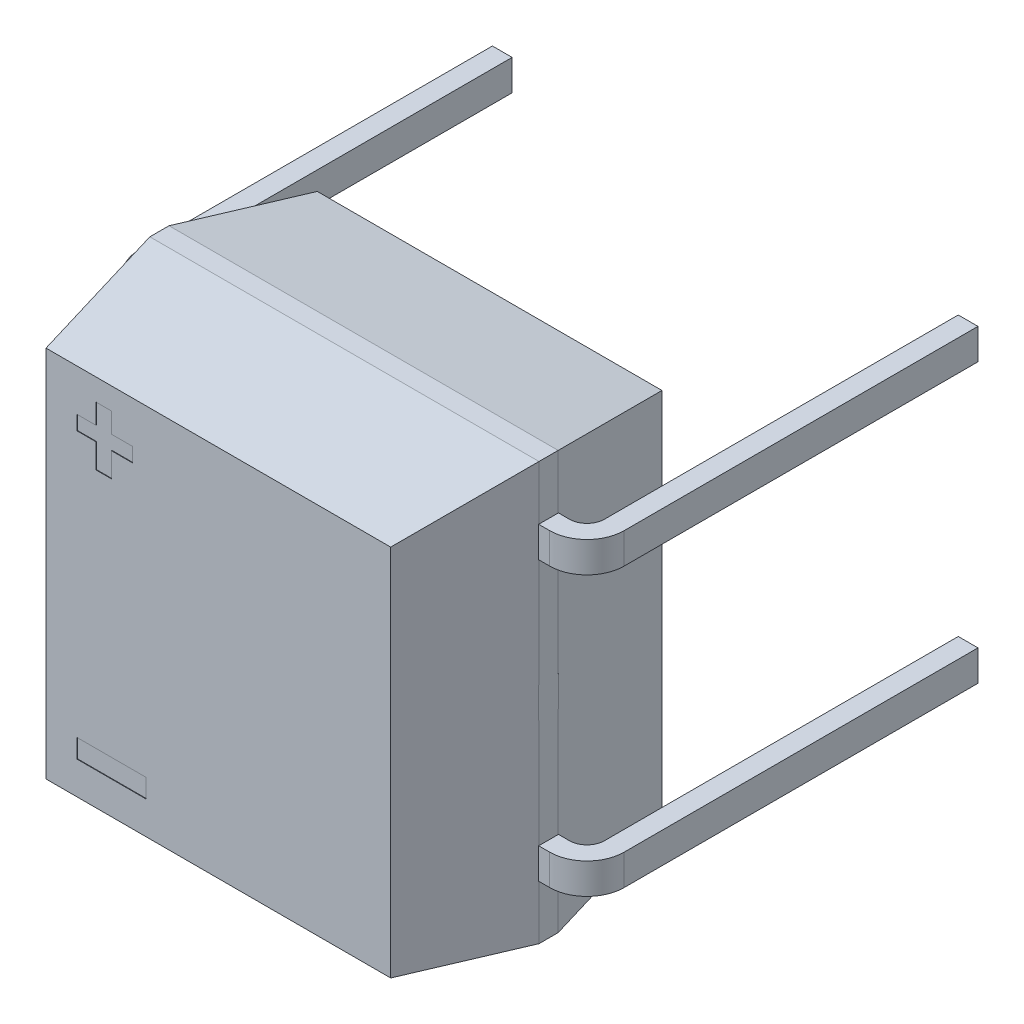
from build123d import *

# Parameters (mm, degrees)
EXTRUDE_1_DEPTH     = 4.95
SKETCH_5_W          = 0.36
SKETCH_5_H          = 0.56
SKETCH_5_2_W        = 0.36
SKETCH_5_2_H        = 0.56
EXTRUDE_2_DEPTH     = 4.1
CHAMFER_1_SIZE      = 2.3
CHAMFER_1_SIZE_2    = 0.405552056
SKETCH_6_W          = 1.256035052
SKETCH_6_H          = 0.342555014
CUT_EXTRUDE_1_DEPTH = 0.01
SKETCH_7_W          = 10.556189846
SKETCH_7_H          = 3.652287582
CUT_EXTRUDE_2_DEPTH = 20
CHAMFER_2_SIZE      = 2.3
CHAMFER_2_SIZE2     = 0.405552056
SKETCH_8_W          = 1.558579466
SKETCH_8_H          = 2.253785059
SKETCH_8_W_2        = 1.350537768
SKETCH_8_H_2        = 2.346248035
CUT_EXTRUDE_3_DEPTH = 20
SKETCH_9_R          = 0.093378716
CUT_EXTRUDE_4_DEPTH = 2


with BuildPart() as part:
    # Эскиз3 → Вытянуть1 (new body)
    with BuildSketch(Plane.XY.offset(5.33)):
        Polygon((0.7, 1.27), (4.25, 1.27), (7.8, 1.27), (7.8, -8.89), (0.7, -8.89), align=None)
    extrude(amount=-EXTRUDE_1_DEPTH)

    # По траектории1: sweep along a path in Эскиз4
    with BuildLine(Plane(origin=(0, 0, 0), x_dir=(1, 0, 0), z_dir=(0, 1, 0))) as sweep_1_path:
        Line((0, 0), (0, -2.355))
        ThreePointArc((0, -2.355), (0.146446609, -2.708553391), (0.5, -2.855))
        Line((0.5, -2.855), (0.7, -2.855))
        Line((0.7, -2.855), (7.8, -2.855))
        Line((7.8, -2.855), (8, -2.855))
        ThreePointArc((8, -2.855), (8.353553391, -2.708553391), (8.5, -2.355))
        Line((8.5, -2.355), (8.5, 0))
        Line((8.5, 0), (8.5, 4.1))
    # Эскиз5 → По траектории1 (sweep)
    with BuildSketch(Plane.XY):
        with Locations((0, -2.54)):
            Rectangle(SKETCH_5_W, SKETCH_5_H)
        Rectangle(SKETCH_5_W, SKETCH_5_H)
        with Locations((0, -5.08)):
            Rectangle(SKETCH_5_W, SKETCH_5_H)
        with Locations((0, -7.62)):
            Rectangle(SKETCH_5_W, SKETCH_5_H)
    sweep(path=sweep_1_path.line)

    # Эскиз5<2> → Вытянуть2 (add)
    with BuildSketch(Plane.XY):
        with Locations((0, -2.54)):
            Rectangle(SKETCH_5_2_W, SKETCH_5_2_H)
        Rectangle(SKETCH_5_2_W, SKETCH_5_2_H)
        with Locations((0, -5.08)):
            Rectangle(SKETCH_5_2_W, SKETCH_5_2_H)
        with Locations((0, -7.62)):
            Rectangle(SKETCH_5_2_W, SKETCH_5_2_H)
    extrude(amount=-EXTRUDE_2_DEPTH)

    # Фаска1
    # the kernel refuses this chamfer: 2.3, 0.405552056 mm, written as the material it takes off along each edge
    with BuildSketch(Plane(origin=(13.776639232, -8.89, 0.38), x_dir=(0, -0.006682531656101655, 0.9999776716360548), z_dir=(-1, 0, 0))) as chamfer_1_piece_1:
        Polygon((CHAMFER_1_SIZE * 0.999977671636, CHAMFER_1_SIZE * 0.0066825316561), (-CHAMFER_1_SIZE_2 * 0.00668253165, CHAMFER_1_SIZE_2 * 0.999977670722), (0, 0), align=None)
    extrude(amount=19.053278464, mode=Mode.SUBTRACT)
    with BuildSketch(Plane(origin=(13.776639232, -8.89, 5.33), x_dir=(4.402885138150507e-15, 0.9776715712462588, 0.2101387607674306), z_dir=(-1, 0, 0))) as chamfer_1_piece_2:
        Polygon((CHAMFER_1_SIZE_2 * 0.977671570353, CHAMFER_1_SIZE_2 * 0.210138760575), (-CHAMFER_1_SIZE * 0.210138760767, CHAMFER_1_SIZE * 0.977671571246), (0, 0), align=None)
    extrude(amount=19.053278464, mode=Mode.SUBTRACT)
    with BuildSketch(Plane(origin=(7.8, 7.246639232, 0.38), x_dir=(0.006682531656101655, 0, 0.9999776716360548), z_dir=(0, -1, 0))) as chamfer_1_piece_3_section:
        Polygon((CHAMFER_1_SIZE * 0.999977671636, CHAMFER_1_SIZE * 0.0066825316561), (-CHAMFER_1_SIZE_2 * 0.00668253165, CHAMFER_1_SIZE_2 * 0.999977670722), (0, 0), align=None)
    chamfer_1_piece_3 = extrude(amount=22.113278464, mode=Mode.PRIVATE)
    chamfer_1_piece_3 = split(chamfer_1_piece_3, bisect_by=Plane(origin=(7.799706122, 0.28, 2.676666667), z_dir=(0, 1, 0)), keep=Keep.TOP, mode=Mode.PRIVATE)
    add(chamfer_1_piece_3, mode=Mode.SUBTRACT)
    with BuildSketch(Plane(origin=(7.8, 7.246639232, 0.38), x_dir=(0.006682531656101655, 0, 0.9999776716360548), z_dir=(0, -1, 0))) as chamfer_1_piece_4_section:
        Polygon((CHAMFER_1_SIZE * 0.999977671636, CHAMFER_1_SIZE * 0.0066825316561), (-CHAMFER_1_SIZE_2 * 0.00668253165, CHAMFER_1_SIZE_2 * 0.999977670722), (0, 0), align=None)
    chamfer_1_piece_4 = extrude(amount=22.113278464, mode=Mode.PRIVATE)
    chamfer_1_piece_4 = split(chamfer_1_piece_4, bisect_by=Plane(origin=(7.664815344, 0, 2.675), z_dir=(0, 0, -1)), keep=Keep.TOP, mode=Mode.PRIVATE)
    add(chamfer_1_piece_4, mode=Mode.SUBTRACT)
    with BuildSketch(Plane(origin=(7.8, 7.246639232, 0.38), x_dir=(0.006682531656101655, 0, 0.9999776716360548), z_dir=(0, -1, 0))) as chamfer_1_piece_5_section:
        Polygon((CHAMFER_1_SIZE * 0.999977671636, CHAMFER_1_SIZE * 0.0066825316561), (-CHAMFER_1_SIZE_2 * 0.00668253165, CHAMFER_1_SIZE_2 * 0.999977670722), (0, 0), align=None)
    chamfer_1_piece_5 = extrude(amount=22.113278464, mode=Mode.PRIVATE)
    chamfer_1_piece_5 = split(chamfer_1_piece_5, bisect_by=Plane(origin=(7.799706122, -2.26, 2.676666667), z_dir=(0, 1, 0)), keep=Keep.TOP, mode=Mode.PRIVATE)
    chamfer_1_piece_5 = split(chamfer_1_piece_5, bisect_by=Plane(origin=(7.799706122, -0.28, 2.676666667), z_dir=(0, -1, 0)), keep=Keep.TOP, mode=Mode.PRIVATE)
    add(chamfer_1_piece_5, mode=Mode.SUBTRACT)
    with BuildSketch(Plane(origin=(7.8, 7.246639232, 0.38), x_dir=(0.006682531656101655, 0, 0.9999776716360548), z_dir=(0, -1, 0))) as chamfer_1_piece_6_section:
        Polygon((CHAMFER_1_SIZE * 0.999977671636, CHAMFER_1_SIZE * 0.0066825316561), (-CHAMFER_1_SIZE_2 * 0.00668253165, CHAMFER_1_SIZE_2 * 0.999977670722), (0, 0), align=None)
    chamfer_1_piece_6 = extrude(amount=22.113278464, mode=Mode.PRIVATE)
    chamfer_1_piece_6 = split(chamfer_1_piece_6, bisect_by=Plane(origin=(7.799706122, -2.82, 2.676666667), z_dir=(0, -1, 0)), keep=Keep.TOP, mode=Mode.PRIVATE)
    chamfer_1_piece_6 = split(chamfer_1_piece_6, bisect_by=Plane(origin=(7.799706122, -4.8, 2.676666667), z_dir=(0, 1, 0)), keep=Keep.TOP, mode=Mode.PRIVATE)
    add(chamfer_1_piece_6, mode=Mode.SUBTRACT)
    with BuildSketch(Plane(origin=(7.8, 7.246639232, 0.38), x_dir=(0.006682531656101655, 0, 0.9999776716360548), z_dir=(0, -1, 0))) as chamfer_1_piece_7_section:
        Polygon((CHAMFER_1_SIZE * 0.999977671636, CHAMFER_1_SIZE * 0.0066825316561), (-CHAMFER_1_SIZE_2 * 0.00668253165, CHAMFER_1_SIZE_2 * 0.999977670722), (0, 0), align=None)
    chamfer_1_piece_7 = extrude(amount=22.113278464, mode=Mode.PRIVATE)
    chamfer_1_piece_7 = split(chamfer_1_piece_7, bisect_by=Plane(origin=(7.799706122, -7.34, 2.676666667), z_dir=(0, 1, 0)), keep=Keep.TOP, mode=Mode.PRIVATE)
    chamfer_1_piece_7 = split(chamfer_1_piece_7, bisect_by=Plane(origin=(7.799706122, -5.36, 2.676666667), z_dir=(0, -1, 0)), keep=Keep.TOP, mode=Mode.PRIVATE)
    add(chamfer_1_piece_7, mode=Mode.SUBTRACT)
    with BuildSketch(Plane(origin=(7.8, 7.246639232, 0.38), x_dir=(0.006682531656101655, 0, 0.9999776716360548), z_dir=(0, -1, 0))) as chamfer_1_piece_8_section:
        Polygon((CHAMFER_1_SIZE * 0.999977671636, CHAMFER_1_SIZE * 0.0066825316561), (-CHAMFER_1_SIZE_2 * 0.00668253165, CHAMFER_1_SIZE_2 * 0.999977670722), (0, 0), align=None)
    chamfer_1_piece_8 = extrude(amount=22.113278464, mode=Mode.PRIVATE)
    chamfer_1_piece_8 = split(chamfer_1_piece_8, bisect_by=Plane(origin=(7.799706122, -7.9, 2.676666667), z_dir=(0, -1, 0)), keep=Keep.TOP, mode=Mode.PRIVATE)
    add(chamfer_1_piece_8, mode=Mode.SUBTRACT)
    with BuildSketch(Plane(origin=(7.8, 7.246639232, 5.33), x_dir=(-0.9776715712462587, -1.3674752616302956e-15, 0.21013876076743102), z_dir=(0, -1, 0))) as chamfer_1_piece_9_section:
        Polygon((CHAMFER_1_SIZE_2 * 0.977671570353, CHAMFER_1_SIZE_2 * 0.210138760575), (-CHAMFER_1_SIZE * 0.210138760767, CHAMFER_1_SIZE * 0.977671571246), (0, 0), align=None)
    chamfer_1_piece_9 = extrude(amount=22.113278464, mode=Mode.PRIVATE)
    chamfer_1_piece_9 = split(chamfer_1_piece_9, bisect_by=Plane(origin=(7.664815344, 0.775, 3.035), z_dir=(0, 0, 1)), keep=Keep.TOP, mode=Mode.PRIVATE)
    add(chamfer_1_piece_9, mode=Mode.SUBTRACT)
    with BuildSketch(Plane(origin=(7.8, 7.246639232, 5.33), x_dir=(-0.9776715712462587, -1.3674752616302956e-15, 0.21013876076743102), z_dir=(0, -1, 0))) as chamfer_1_piece_10_section:
        Polygon((CHAMFER_1_SIZE_2 * 0.977671570353, CHAMFER_1_SIZE_2 * 0.210138760575), (-CHAMFER_1_SIZE * 0.210138760767, CHAMFER_1_SIZE * 0.977671571246), (0, 0), align=None)
    chamfer_1_piece_10 = extrude(amount=22.113278464, mode=Mode.PRIVATE)
    chamfer_1_piece_10 = split(chamfer_1_piece_10, bisect_by=Plane(origin=(7.799706122, 0.28, 3.033333333), z_dir=(0, 1, 0)), keep=Keep.TOP, mode=Mode.PRIVATE)
    add(chamfer_1_piece_10, mode=Mode.SUBTRACT)
    with BuildSketch(Plane(origin=(7.8, 7.246639232, 5.33), x_dir=(-0.9776715712462587, -1.3674752616302956e-15, 0.21013876076743102), z_dir=(0, -1, 0))) as chamfer_1_piece_11_section:
        Polygon((CHAMFER_1_SIZE_2 * 0.977671570353, CHAMFER_1_SIZE_2 * 0.210138760575), (-CHAMFER_1_SIZE * 0.210138760767, CHAMFER_1_SIZE * 0.977671571246), (0, 0), align=None)
    chamfer_1_piece_11 = extrude(amount=22.113278464, mode=Mode.PRIVATE)
    chamfer_1_piece_11 = split(chamfer_1_piece_11, bisect_by=Plane(origin=(7.799706122, -2.26, 3.033333333), z_dir=(0, 1, 0)), keep=Keep.TOP, mode=Mode.PRIVATE)
    chamfer_1_piece_11 = split(chamfer_1_piece_11, bisect_by=Plane(origin=(7.799706122, -0.28, 3.033333333), z_dir=(0, -1, 0)), keep=Keep.TOP, mode=Mode.PRIVATE)
    add(chamfer_1_piece_11, mode=Mode.SUBTRACT)
    with BuildSketch(Plane(origin=(7.8, 7.246639232, 5.33), x_dir=(-0.9776715712462587, -1.3674752616302956e-15, 0.21013876076743102), z_dir=(0, -1, 0))) as chamfer_1_piece_12_section:
        Polygon((CHAMFER_1_SIZE_2 * 0.977671570353, CHAMFER_1_SIZE_2 * 0.210138760575), (-CHAMFER_1_SIZE * 0.210138760767, CHAMFER_1_SIZE * 0.977671571246), (0, 0), align=None)
    chamfer_1_piece_12 = extrude(amount=22.113278464, mode=Mode.PRIVATE)
    chamfer_1_piece_12 = split(chamfer_1_piece_12, bisect_by=Plane(origin=(7.799706122, -2.82, 3.033333333), z_dir=(0, -1, 0)), keep=Keep.TOP, mode=Mode.PRIVATE)
    chamfer_1_piece_12 = split(chamfer_1_piece_12, bisect_by=Plane(origin=(7.799706122, -4.8, 3.033333333), z_dir=(0, 1, 0)), keep=Keep.TOP, mode=Mode.PRIVATE)
    add(chamfer_1_piece_12, mode=Mode.SUBTRACT)
    with BuildSketch(Plane(origin=(7.8, 7.246639232, 5.33), x_dir=(-0.9776715712462587, -1.3674752616302956e-15, 0.21013876076743102), z_dir=(0, -1, 0))) as chamfer_1_piece_13_section:
        Polygon((CHAMFER_1_SIZE_2 * 0.977671570353, CHAMFER_1_SIZE_2 * 0.210138760575), (-CHAMFER_1_SIZE * 0.210138760767, CHAMFER_1_SIZE * 0.977671571246), (0, 0), align=None)
    chamfer_1_piece_13 = extrude(amount=22.113278464, mode=Mode.PRIVATE)
    chamfer_1_piece_13 = split(chamfer_1_piece_13, bisect_by=Plane(origin=(7.799706122, -7.34, 3.033333333), z_dir=(0, 1, 0)), keep=Keep.TOP, mode=Mode.PRIVATE)
    chamfer_1_piece_13 = split(chamfer_1_piece_13, bisect_by=Plane(origin=(7.799706122, -5.36, 3.033333333), z_dir=(0, -1, 0)), keep=Keep.TOP, mode=Mode.PRIVATE)
    add(chamfer_1_piece_13, mode=Mode.SUBTRACT)
    with BuildSketch(Plane(origin=(7.8, 7.246639232, 5.33), x_dir=(-0.9776715712462587, -1.3674752616302956e-15, 0.21013876076743102), z_dir=(0, -1, 0))) as chamfer_1_piece_14_section:
        Polygon((CHAMFER_1_SIZE_2 * 0.977671570353, CHAMFER_1_SIZE_2 * 0.210138760575), (-CHAMFER_1_SIZE * 0.210138760767, CHAMFER_1_SIZE * 0.977671571246), (0, 0), align=None)
    chamfer_1_piece_14 = extrude(amount=22.113278464, mode=Mode.PRIVATE)
    chamfer_1_piece_14 = split(chamfer_1_piece_14, bisect_by=Plane(origin=(7.799706122, -7.9, 3.033333333), z_dir=(0, -1, 0)), keep=Keep.TOP, mode=Mode.PRIVATE)
    add(chamfer_1_piece_14, mode=Mode.SUBTRACT)
    with BuildSketch(Plane(origin=(13.776639232, 1.27, 0.38), x_dir=(0, 0.006682531656101748, 0.9999776716360548), z_dir=(-1, 0, 0)), Plane(origin=(-5.276639232, 1.27, 5.33), x_dir=(0, 0.006682531656101748, -0.9999776716360548), z_dir=(1, 0, 0))) as chamfer_1_piece_15:
        Polygon((CHAMFER_1_SIZE * 0.999977671636, -CHAMFER_1_SIZE * 0.0066825316561), (-CHAMFER_1_SIZE_2 * 0.00668253165, -CHAMFER_1_SIZE_2 * 0.999977670722), (0, 0), align=None)
    extrude(amount=19.053278464, mode=Mode.SUBTRACT)
    with BuildSketch(Plane(origin=(0.7, -14.866639232, 0.38), x_dir=(0.9776715712462587, 0, -0.2101387607674313), z_dir=(0, 1, 0))) as chamfer_1_piece_16_section:
        Polygon((CHAMFER_1_SIZE_2 * 0.977671570353, -CHAMFER_1_SIZE_2 * 0.210138760575), (-CHAMFER_1_SIZE * 0.210138760767, -CHAMFER_1_SIZE * 0.977671571246), (0, 0), align=None)
    chamfer_1_piece_16 = extrude(amount=22.113278464, mode=Mode.PRIVATE)
    chamfer_1_piece_16 = split(chamfer_1_piece_16, bisect_by=Plane(origin=(0.835184656, -8.395, 2.675), z_dir=(0, 0, -1)), keep=Keep.TOP, mode=Mode.PRIVATE)
    add(chamfer_1_piece_16, mode=Mode.SUBTRACT)
    with BuildSketch(Plane(origin=(0.7, -14.866639232, 0.38), x_dir=(0.9776715712462587, 0, -0.2101387607674313), z_dir=(0, 1, 0))) as chamfer_1_piece_17_section:
        Polygon((CHAMFER_1_SIZE_2 * 0.977671570353, -CHAMFER_1_SIZE_2 * 0.210138760575), (-CHAMFER_1_SIZE * 0.210138760767, -CHAMFER_1_SIZE * 0.977671571246), (0, 0), align=None)
    chamfer_1_piece_17 = extrude(amount=22.113278464, mode=Mode.PRIVATE)
    chamfer_1_piece_17 = split(chamfer_1_piece_17, bisect_by=Plane(origin=(0.700293878, -7.9, 2.676666667), z_dir=(0, -1, 0)), keep=Keep.TOP, mode=Mode.PRIVATE)
    add(chamfer_1_piece_17, mode=Mode.SUBTRACT)
    with BuildSketch(Plane(origin=(0.7, -14.866639232, 0.38), x_dir=(0.9776715712462587, 0, -0.2101387607674313), z_dir=(0, 1, 0))) as chamfer_1_piece_18_section:
        Polygon((CHAMFER_1_SIZE_2 * 0.977671570353, -CHAMFER_1_SIZE_2 * 0.210138760575), (-CHAMFER_1_SIZE * 0.210138760767, -CHAMFER_1_SIZE * 0.977671571246), (0, 0), align=None)
    chamfer_1_piece_18 = extrude(amount=22.113278464, mode=Mode.PRIVATE)
    chamfer_1_piece_18 = split(chamfer_1_piece_18, bisect_by=Plane(origin=(0.700293878, -5.36, 2.676666667), z_dir=(0, -1, 0)), keep=Keep.TOP, mode=Mode.PRIVATE)
    chamfer_1_piece_18 = split(chamfer_1_piece_18, bisect_by=Plane(origin=(0.700293878, -7.34, 2.676666667), z_dir=(0, 1, 0)), keep=Keep.TOP, mode=Mode.PRIVATE)
    add(chamfer_1_piece_18, mode=Mode.SUBTRACT)
    with BuildSketch(Plane(origin=(0.7, -14.866639232, 0.38), x_dir=(0.9776715712462587, 0, -0.2101387607674313), z_dir=(0, 1, 0))) as chamfer_1_piece_19_section:
        Polygon((CHAMFER_1_SIZE_2 * 0.977671570353, -CHAMFER_1_SIZE_2 * 0.210138760575), (-CHAMFER_1_SIZE * 0.210138760767, -CHAMFER_1_SIZE * 0.977671571246), (0, 0), align=None)
    chamfer_1_piece_19 = extrude(amount=22.113278464, mode=Mode.PRIVATE)
    chamfer_1_piece_19 = split(chamfer_1_piece_19, bisect_by=Plane(origin=(0.700293878, -2.82, 2.676666667), z_dir=(0, -1, 0)), keep=Keep.TOP, mode=Mode.PRIVATE)
    chamfer_1_piece_19 = split(chamfer_1_piece_19, bisect_by=Plane(origin=(0.700293878, -4.8, 2.676666667), z_dir=(0, 1, 0)), keep=Keep.TOP, mode=Mode.PRIVATE)
    add(chamfer_1_piece_19, mode=Mode.SUBTRACT)
    with BuildSketch(Plane(origin=(0.7, -14.866639232, 0.38), x_dir=(0.9776715712462587, 0, -0.2101387607674313), z_dir=(0, 1, 0))) as chamfer_1_piece_20_section:
        Polygon((CHAMFER_1_SIZE_2 * 0.977671570353, -CHAMFER_1_SIZE_2 * 0.210138760575), (-CHAMFER_1_SIZE * 0.210138760767, -CHAMFER_1_SIZE * 0.977671571246), (0, 0), align=None)
    chamfer_1_piece_20 = extrude(amount=22.113278464, mode=Mode.PRIVATE)
    chamfer_1_piece_20 = split(chamfer_1_piece_20, bisect_by=Plane(origin=(0.700293878, -0.28, 2.676666667), z_dir=(0, -1, 0)), keep=Keep.TOP, mode=Mode.PRIVATE)
    chamfer_1_piece_20 = split(chamfer_1_piece_20, bisect_by=Plane(origin=(0.700293878, -2.26, 2.676666667), z_dir=(0, 1, 0)), keep=Keep.TOP, mode=Mode.PRIVATE)
    add(chamfer_1_piece_20, mode=Mode.SUBTRACT)
    with BuildSketch(Plane(origin=(0.7, -14.866639232, 0.38), x_dir=(0.9776715712462587, 0, -0.2101387607674313), z_dir=(0, 1, 0))) as chamfer_1_piece_21_section:
        Polygon((CHAMFER_1_SIZE_2 * 0.977671570353, -CHAMFER_1_SIZE_2 * 0.210138760575), (-CHAMFER_1_SIZE * 0.210138760767, -CHAMFER_1_SIZE * 0.977671571246), (0, 0), align=None)
    chamfer_1_piece_21 = extrude(amount=22.113278464, mode=Mode.PRIVATE)
    chamfer_1_piece_21 = split(chamfer_1_piece_21, bisect_by=Plane(origin=(0.700293878, 0.28, 2.676666667), z_dir=(0, 1, 0)), keep=Keep.TOP, mode=Mode.PRIVATE)
    add(chamfer_1_piece_21, mode=Mode.SUBTRACT)
    with BuildSketch(Plane(origin=(0.7, -14.866639232, 5.33), x_dir=(0.9776715712462587, 0, 0.2101387607674309), z_dir=(0, 1, 0))) as chamfer_1_piece_22_section:
        Polygon((CHAMFER_1_SIZE_2 * 0.977671570353, CHAMFER_1_SIZE_2 * 0.210138760575), (-CHAMFER_1_SIZE * 0.210138760767, CHAMFER_1_SIZE * 0.977671571246), (0, 0), align=None)
    chamfer_1_piece_22 = extrude(amount=22.113278464, mode=Mode.PRIVATE)
    chamfer_1_piece_22 = split(chamfer_1_piece_22, bisect_by=Plane(origin=(0.835184656, -8.395, 3.035), z_dir=(0, 0, 1)), keep=Keep.TOP, mode=Mode.PRIVATE)
    add(chamfer_1_piece_22, mode=Mode.SUBTRACT)
    with BuildSketch(Plane(origin=(0.7, -14.866639232, 5.33), x_dir=(0.9776715712462587, 0, 0.2101387607674309), z_dir=(0, 1, 0))) as chamfer_1_piece_23_section:
        Polygon((CHAMFER_1_SIZE_2 * 0.977671570353, CHAMFER_1_SIZE_2 * 0.210138760575), (-CHAMFER_1_SIZE * 0.210138760767, CHAMFER_1_SIZE * 0.977671571246), (0, 0), align=None)
    chamfer_1_piece_23 = extrude(amount=22.113278464, mode=Mode.PRIVATE)
    chamfer_1_piece_23 = split(chamfer_1_piece_23, bisect_by=Plane(origin=(0.700293878, -7.9, 3.033333333), z_dir=(0, -1, 0)), keep=Keep.TOP, mode=Mode.PRIVATE)
    add(chamfer_1_piece_23, mode=Mode.SUBTRACT)
    with BuildSketch(Plane(origin=(0.7, -14.866639232, 5.33), x_dir=(0.9776715712462587, 0, 0.2101387607674309), z_dir=(0, 1, 0))) as chamfer_1_piece_24_section:
        Polygon((CHAMFER_1_SIZE_2 * 0.977671570353, CHAMFER_1_SIZE_2 * 0.210138760575), (-CHAMFER_1_SIZE * 0.210138760767, CHAMFER_1_SIZE * 0.977671571246), (0, 0), align=None)
    chamfer_1_piece_24 = extrude(amount=22.113278464, mode=Mode.PRIVATE)
    chamfer_1_piece_24 = split(chamfer_1_piece_24, bisect_by=Plane(origin=(0.700293878, -5.36, 3.033333333), z_dir=(0, -1, 0)), keep=Keep.TOP, mode=Mode.PRIVATE)
    chamfer_1_piece_24 = split(chamfer_1_piece_24, bisect_by=Plane(origin=(0.700293878, -7.34, 3.033333333), z_dir=(0, 1, 0)), keep=Keep.TOP, mode=Mode.PRIVATE)
    add(chamfer_1_piece_24, mode=Mode.SUBTRACT)
    with BuildSketch(Plane(origin=(0.7, -14.866639232, 5.33), x_dir=(0.9776715712462587, 0, 0.2101387607674309), z_dir=(0, 1, 0))) as chamfer_1_piece_25_section:
        Polygon((CHAMFER_1_SIZE_2 * 0.977671570353, CHAMFER_1_SIZE_2 * 0.210138760575), (-CHAMFER_1_SIZE * 0.210138760767, CHAMFER_1_SIZE * 0.977671571246), (0, 0), align=None)
    chamfer_1_piece_25 = extrude(amount=22.113278464, mode=Mode.PRIVATE)
    chamfer_1_piece_25 = split(chamfer_1_piece_25, bisect_by=Plane(origin=(0.700293878, -2.82, 3.033333333), z_dir=(0, -1, 0)), keep=Keep.TOP, mode=Mode.PRIVATE)
    chamfer_1_piece_25 = split(chamfer_1_piece_25, bisect_by=Plane(origin=(0.700293878, -4.8, 3.033333333), z_dir=(0, 1, 0)), keep=Keep.TOP, mode=Mode.PRIVATE)
    add(chamfer_1_piece_25, mode=Mode.SUBTRACT)
    with BuildSketch(Plane(origin=(0.7, -14.866639232, 5.33), x_dir=(0.9776715712462587, 0, 0.2101387607674309), z_dir=(0, 1, 0))) as chamfer_1_piece_26_section:
        Polygon((CHAMFER_1_SIZE_2 * 0.977671570353, CHAMFER_1_SIZE_2 * 0.210138760575), (-CHAMFER_1_SIZE * 0.210138760767, CHAMFER_1_SIZE * 0.977671571246), (0, 0), align=None)
    chamfer_1_piece_26 = extrude(amount=22.113278464, mode=Mode.PRIVATE)
    chamfer_1_piece_26 = split(chamfer_1_piece_26, bisect_by=Plane(origin=(0.700293878, -0.28, 3.033333333), z_dir=(0, -1, 0)), keep=Keep.TOP, mode=Mode.PRIVATE)
    chamfer_1_piece_26 = split(chamfer_1_piece_26, bisect_by=Plane(origin=(0.700293878, -2.26, 3.033333333), z_dir=(0, 1, 0)), keep=Keep.TOP, mode=Mode.PRIVATE)
    add(chamfer_1_piece_26, mode=Mode.SUBTRACT)
    with BuildSketch(Plane(origin=(0.7, -14.866639232, 5.33), x_dir=(0.9776715712462587, 0, 0.2101387607674309), z_dir=(0, 1, 0))) as chamfer_1_piece_27_section:
        Polygon((CHAMFER_1_SIZE_2 * 0.977671570353, CHAMFER_1_SIZE_2 * 0.210138760575), (-CHAMFER_1_SIZE * 0.210138760767, CHAMFER_1_SIZE * 0.977671571246), (0, 0), align=None)
    chamfer_1_piece_27 = extrude(amount=22.113278464, mode=Mode.PRIVATE)
    chamfer_1_piece_27 = split(chamfer_1_piece_27, bisect_by=Plane(origin=(0.700293878, 0.28, 3.033333333), z_dir=(0, 1, 0)), keep=Keep.TOP, mode=Mode.PRIVATE)
    add(chamfer_1_piece_27, mode=Mode.SUBTRACT)

    # Эскиз6 → Вырез-Вытянуть1 (cut)
    with BuildSketch(Plane.XY.offset(5.33)):
        Polygon((2.300698847, 0.100363767), (2.68403422, 0.100363767), (2.68403422, -0.16063053), (2.300698847, -0.16063053), (2.300698847, -0.605114081), (2.017762426, -0.605114081), (2.017762426, -0.16063053), (1.672681321, -0.16063053), (1.672681321, 0.100363767), (2.017762426, 0.100363767), (2.017762426, 0.467499156), (2.300698847, 0.467499156), align=None)
        with Locations((2.300698847, -5.176614669)):
            Rectangle(SKETCH_6_W, SKETCH_6_H)
    extrude(amount=-CUT_EXTRUDE_1_DEPTH, mode=Mode.SUBTRACT)

    # Эскиз7 → Вырез-Вытянуть2 (cut)
    with BuildSketch(Plane.XY.offset(5.33)):
        with Locations((4.103600287, -8.176143791)):
            Rectangle(SKETCH_7_W, SKETCH_7_H)
    extrude(amount=-CUT_EXTRUDE_2_DEPTH, mode=Mode.SUBTRACT)

    # Фаска2
    chamfer_2_edges = [part.edges().sort_by_distance(p)[0] for p in [
        (4.25, -6.35, 0.38),
        (4.25, -6.35, 5.33),
    ]]
    chamfer_2_side = [part.faces().sort_by_distance(p)[0] for p in [
        (4.25, -6.35, 2.855),
    ]]
    chamfer(chamfer_2_edges, length=CHAMFER_2_SIZE, length2=CHAMFER_2_SIZE2, reference=chamfer_2_side[0])

    # Эскиз8 → Вырез-Вытянуть3 (cut)
    with BuildSketch(Plane.XY.offset(5.33)):
        with Locations((8.579289733, -2.470652768)):
            Rectangle(SKETCH_8_W, SKETCH_8_H)
        with Locations((0.024731116, -2.516884255)):
            Rectangle(SKETCH_8_W_2, SKETCH_8_H_2)
    extrude(amount=-CUT_EXTRUDE_3_DEPTH, mode=Mode.SUBTRACT)

    # Эскиз9 → Вырез-Вытянуть4 (cut)
    with BuildSketch(Plane(origin=(0, 0, -4.1), x_dir=(-1, 0, 0), z_dir=(0, 0, -1))):
        Circle(SKETCH_9_R)
    extrude(amount=-CUT_EXTRUDE_4_DEPTH, mode=Mode.SUBTRACT)


solid = part.part
